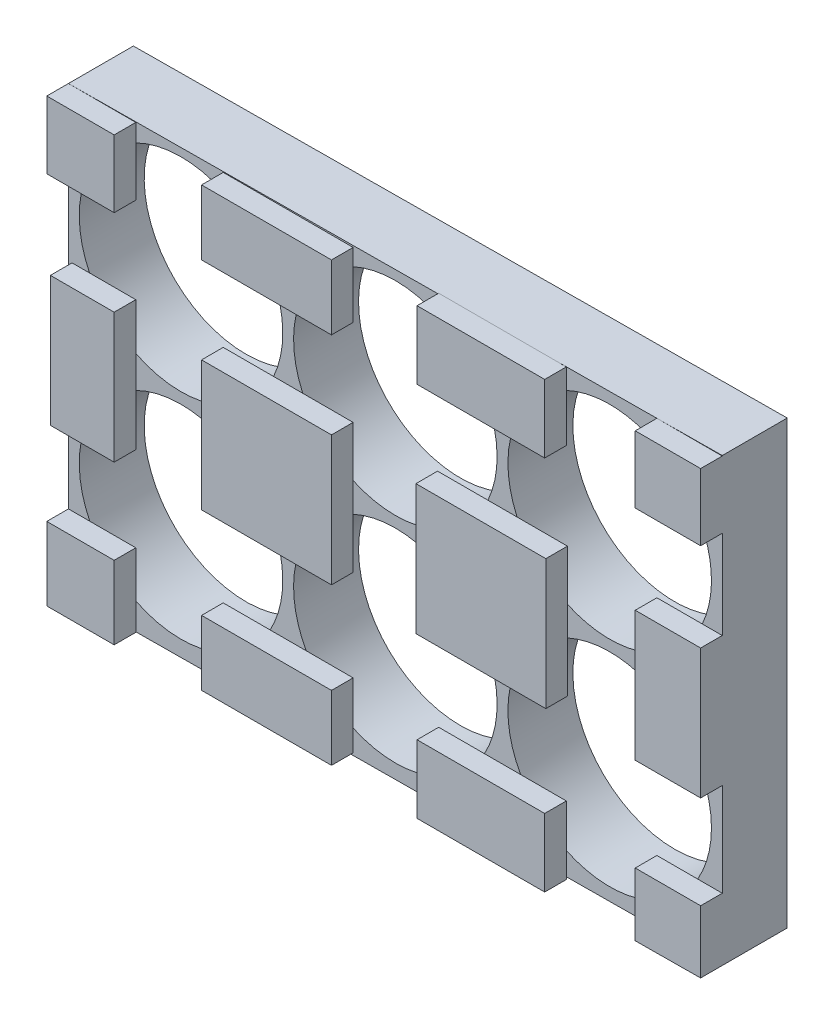
from build123d import *

# Parameters (mm, degrees)
MODEL_R         = 9.4
MODEL_R_2       = 2.5
EXTRUDE_1_DEPTH = 6
SKETCH_2_W      = 6.222861065
SKETCH_2_H      = 6.222861065
SKETCH_2_W_2    = 12
SKETCH_2_H_2    = 6
SKETCH_2_W_3    = 11.79
SKETCH_2_H_3    = 6.29
SKETCH_2_W_4    = 6.039723033
SKETCH_2_H_4    = 6.178960273
SKETCH_2_H_5    = 12
SKETCH_2_W_5    = 5.890334081
SKETCH_2_H_6    = 6.764977387
EXTRUDE_2_DEPTH = 2


with BuildPart() as part:
    # Model → 凸台-拉伸1 (new body)
    with BuildSketch(Plane.XY):
        Polygon((1072.862228674, 1168.347447046), (1072.862228674, 1127.547447046), (1012.463824187, 1127.108430595), (1012.463824187, 1167.908430595), align=None)
        with Locations((1022.862228674, 1157.847447046)):
            Circle(MODEL_R, mode=Mode.SUBTRACT)
        with Locations((1042.662228674, 1157.847447046)):
            Circle(MODEL_R, mode=Mode.SUBTRACT)
        with Locations((1062.462228674, 1157.847447046)):
            Circle(MODEL_R, mode=Mode.SUBTRACT)
        with Locations((1022.862228674, 1138.047447046)):
            Circle(MODEL_R, mode=Mode.SUBTRACT)
        with Locations((1042.662228674, 1138.047447046)):
            Circle(MODEL_R, mode=Mode.SUBTRACT)
        with Locations((1062.462228674, 1138.047447046)):
            Circle(MODEL_R, mode=Mode.SUBTRACT)
        with Locations((1032.762228674, 1147.947447046)):
            Circle(MODEL_R_2, mode=Mode.SUBTRACT)
        with Locations((1052.562228674, 1147.947447046)):
            Circle(MODEL_R_2, mode=Mode.SUBTRACT)
    extrude(amount=EXTRUDE_1_DEPTH)

    # 草图2 → 凸台-拉伸2 (add)
    with BuildSketch(Plane.XY.offset(6)):
        with Locations((1015.57525472, 1164.797000063)):
            Rectangle(SKETCH_2_W, SKETCH_2_H)
        Polygon((1072.862228674, 1133.328066092), (1072.862228674, 1127.547447046), (1066.822505641, 1127.503546254), (1066.822505641, 1133.328066092), align=None)
        with Locations((1032.763038583, 1164.944548481)):
            Rectangle(SKETCH_2_W_2, SKETCH_2_H_2)
        with Locations((1052.562228674, 1165.088462385)):
            Rectangle(SKETCH_2_W_3, SKETCH_2_H_3)
        with Locations((1069.842367158, 1165.214066118)):
            Rectangle(SKETCH_2_W_4, SKETCH_2_H_4)
        with Locations((1032.762228674, 1147.947447046)):
            Rectangle(SKETCH_2_W_2, SKETCH_2_H_5)
        with Locations((1052.562228674, 1147.947447046)):
            Rectangle(SKETCH_2_W_2, SKETCH_2_H_5)
        with Locations((1069.842367158, 1147.947447046)):
            Rectangle(SKETCH_2_W_4, SKETCH_2_H_5)
        with Locations((1015.741518212, 1147.726326037)):
            Rectangle(SKETCH_2_W_5, SKETCH_2_H_5)
        with Locations((1052.562228674, 1130.364189688)):
            Rectangle(SKETCH_2_W_3, SKETCH_2_H_3)
        with Locations((1032.763038583, 1130.508103592)):
            Rectangle(SKETCH_2_W_2, SKETCH_2_H_2)
        with Locations((1015.57525472, 1130.493598172)):
            Rectangle(SKETCH_2_W, SKETCH_2_H_6)
    extrude(amount=EXTRUDE_2_DEPTH)


solid = part.part
